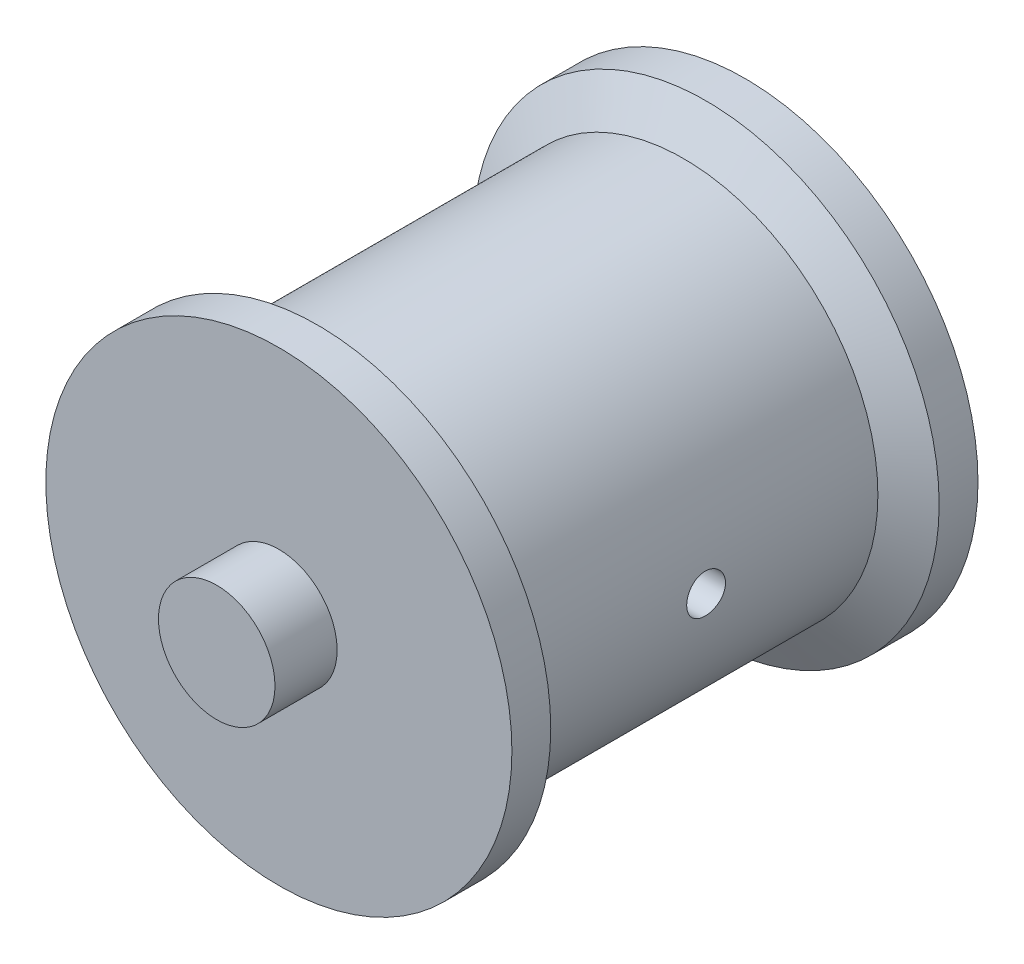
from build123d import *
from OCP.BRepFilletAPI import BRepFilletAPI_MakeChamfer

# Parameters (mm, degrees)
SKETCH2_R               = 10
BOSS_EXTRUDE1_DEPTH     = 10
SKETCH3_R               = 25
BOSS_EXTRUDE2_DEPTH     = 60
SKETCH4_R               = 30
BOSS_EXTRUDE3_DEPTH     = 5
CHAMFER1_SIZE           = 2.886751346
CHAMFER1_SIZE_2         = 5
CUT_EXTRUDE1_DEPTH      = 82.853527719
CUT_EXTRUDE1_DEPTH_BACK = 82.853527719
SKETCH5_R               = 2.5
SKETCH6_R               = 7.5
BOSS_EXTRUDE4_DEPTH     = 8


with BuildPart() as part:
    # Sketch2 → Boss-Extrude1 (new body)
    with BuildSketch(Plane.XY):
        Circle(SKETCH2_R)
        with BuildLine():
            Line((-1.58113883, 2.25), (1.58113883, 2.25))
            ThreePointArc((1.58113883, 2.25), (0, -2.75), (-1.58113883, 2.25))
        make_face(mode=Mode.SUBTRACT)
    extrude(amount=BOSS_EXTRUDE1_DEPTH)

    # Sketch3 → Boss-Extrude2 (add)
    with BuildSketch(Plane.XY.offset(10)):
        Circle(SKETCH3_R)
    extrude(amount=BOSS_EXTRUDE2_DEPTH)

    # Sketch4 → Boss-Extrude3 (add)
    with BuildSketch(Plane.XY.offset(70)):
        Circle(SKETCH4_R)
    boss_extrude3 = extrude(amount=-BOSS_EXTRUDE3_DEPTH)

    # Mirror1: Boss-Extrude3 across plane
    add(boss_extrude3.mirror(Plane.XY.offset(40)))

    # Chamfer1
    chamfer1_edges_1 = [part.edges().sort_by_distance(p)[0] for p in [
        (-25, 0, 65),
    ]]
    chamfer1_side_1 = [part.faces().sort_by_distance(p)[0] for p in [
        (-25, 0, 64.942264973),
    ]]
    chamfer1_edges_2 = [part.edges().sort_by_distance(p)[0] for p in [
        (-25, 0, 15),
    ]]
    chamfer1_side_2 = [part.faces().sort_by_distance(p)[0] for p in [
        (-25.057735027, 0, 15),
    ]]
    chamfer1 = BRepFilletAPI_MakeChamfer(part.part.solid().wrapped)
    for e in chamfer1_edges_1:
        chamfer1.Add(CHAMFER1_SIZE - 0.0001, CHAMFER1_SIZE_2 - 0.0001, e.wrapped, chamfer1_side_1[0].wrapped)
    for e in chamfer1_edges_2:
        chamfer1.Add(CHAMFER1_SIZE_2 - 0.0001, CHAMFER1_SIZE - 0.0001, e.wrapped, chamfer1_side_2[0].wrapped)
    add(Compound.cast(chamfer1.Shape()), mode=Mode.REPLACE)  # a hair under: the kernel refuses the full size

    # Sketch5 → Cut-Extrude1 (cut, two sides: drawn at the far end of the back side and taken through both)
    with BuildSketch(Plane(origin=(0, 0, 0), x_dir=(0, 0, -1), z_dir=(1, 0, 0)).offset(-CUT_EXTRUDE1_DEPTH_BACK)):
        with Locations((-40, 0)):
            Circle(SKETCH5_R)
    extrude(amount=CUT_EXTRUDE1_DEPTH + CUT_EXTRUDE1_DEPTH_BACK, mode=Mode.SUBTRACT)

    # Sketch6 → Boss-Extrude4 (add)
    with BuildSketch(Plane.XY.offset(70)):
        Circle(SKETCH6_R)
    extrude(amount=BOSS_EXTRUDE4_DEPTH)


solid = part.part
